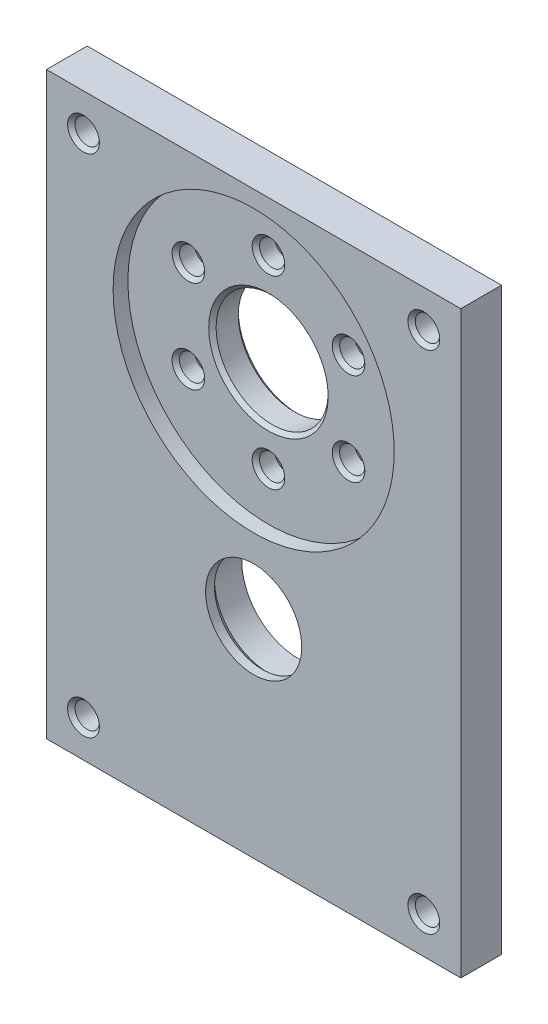
from build123d import *
from OCP.BRepFilletAPI import BRepFilletAPI_MakeChamfer

# Parameters (mm, degrees)
SKETCH1_W                                           = 56
SKETCH1_H                                           = 78.35
SKETCH1_R                                           = 6.5
SKETCH1_R_2                                         = 7.575
BOSS_EXTRUDE1_DEPTH                                 = 5
SKETCH1_4_W                                         = 56
SKETCH1_4_H                                         = 78.35
BOSS_EXTRUDE2_DEPTH                                 = 38
SKETCH4_W                                           = 2
SKETCH4_H                                           = 3
SKETCH7_W                                           = 4.75
SKETCH7_H                                           = 48
BOSS_EXTRUDE3_DEPTH                                 = 15.25
CHAMFER1_SIZE                                       = 17.35
CHAMFER1_SIZE_2                                     = 15.25
SKETCH9_W                                           = 2.7
SKETCH9_H                                           = 5.7
CUT_EXTRUDE11_DEPTH                                 = 8.5
CUT_EXTRUDE12_START                                 = 78.35
SKETCH9_3_W                                         = 2.7
SKETCH9_3_H                                         = 5.7
CUT_EXTRUDE12_DEPTH                                 = 8.5
SKETCH8_R                                           = 1.65
CUT_EXTRUDE5_DEPTH                                  = 175.5
BOSS_EXTRUDE4_START                                 = 38
SKETCH1_5_W                                         = 56
SKETCH1_5_H                                         = 78.35
BOSS_EXTRUDE4_DEPTH                                 = 6
CUT_EXTRUDE2_START                                  = -49
SKETCH2_R                                           = 1.65
CUT_EXTRUDE2_DEPTH                                  = 26
CUT_EXTRUDE6_START                                  = -49
CUT_EXTRUDE6_OUTLINE_R                              = 7.575
CUT_EXTRUDE6_OUTLINE_R_2                            = 6.5
CUT_EXTRUDE6_OUTLINE_R_3                            = 1.65
CUT_EXTRUDE6_DEPTH                                  = 6
CUT_EXTRUDE7_START                                  = -49
SKETCH10_3_R                                        = 19
CUT_EXTRUDE7_DEPTH                                  = 2
CUT_EXTRUDE8_START                                  = -43
SKETCH10_5_R                                        = 7.6
CUT_EXTRUDE8_DEPTH                                  = 4
CUT_EXTRUDE10_START                                 = -6
SKETCH11_2_W                                        = 56
SKETCH11_2_H                                        = 78.35
CUT_EXTRUDE10_DEPTH                                 = 58.25
CSK_FOR_M3_COUNTERSUNK_FLAT_HEAD_SCREW1_D           = 3.4
CSK_FOR_M3_COUNTERSUNK_FLAT_HEAD_SCREW1_DEPTH       = 47
CSK_FOR_M3_COUNTERSUNK_FLAT_HEAD_SCREW1_CSINK_D     = 6.3
CSK_FOR_M3_COUNTERSUNK_FLAT_HEAD_SCREW1_CSINK_ANGLE = 90
CSK_FOR_M3_COUNTERSUNK_FLAT_HEAD_SCREW1_TIP         = 1.021463052
CHAMFER4_SIZE                                       = 0.8
CHAMFER7_SIZE                                       = 0.5


# Read off the part's stored shape, not the designer's step: Cut-Extrude6
with BuildPart() as part:
    # Sketch1 → Boss-Extrude1 (new body)
    with BuildSketch(Plane.XY):
        with Locations((0, 11.175)):
            Rectangle(SKETCH1_W, SKETCH1_H)
        Circle(SKETCH1_R, mode=Mode.SUBTRACT)
        with Locations((0, 29.1)):
            Circle(SKETCH1_R_2, mode=Mode.SUBTRACT)
    extrude(amount=-BOSS_EXTRUDE1_DEPTH)

    # Sketch1<4> → Boss-Extrude2 (add)
    with BuildSketch(Plane.XY):
        with Locations((0, 11.175)):
            Rectangle(SKETCH1_4_W, SKETCH1_4_H)
        with BuildLine():
            ThreePointArc((-9.654082841, 21.972680412), (0, 41.1), (9.654082841, 21.972680412))
            ThreePointArc((9.654082841, 21.972680412), (0, -24), (-9.654082841, 21.972680412))
        make_face(mode=Mode.SUBTRACT)
    extrude(amount=BOSS_EXTRUDE2_DEPTH)

    # Cut-Sweep1: sweep along a path in Sketch3
    with BuildLine(Plane(origin=(0, 0, 38), x_dir=(-1, 0, 0), z_dir=(0, 0, -1))) as cut_sweep1_path:
        Line((26, 0), (26, 26.35))
        ThreePointArc((26, 26.35), (19.556349186, 41.906349186), (4, 48.35))
        Line((4, 48.35), (-4, 48.35))
        ThreePointArc((-4, 48.35), (-19.556349186, 41.906349186), (-26, 26.35))
        Line((-26, 26.35), (-26, -4))
        ThreePointArc((-26, -4), (-19.556349186, -19.556349186), (-4, -26))
        Line((-4, -26), (4, -26))
        ThreePointArc((4, -26), (19.556349186, -19.556349186), (26, -4))
        Line((26, -4), (26, 0))
    # Sketch4 → Cut-Sweep1 (sweep, cut)
    with BuildSketch(Plane(origin=(0, 0, 0), x_dir=(1, 0, 0), z_dir=(0, 1, 0))):
        with Locations((-26, -38.1)):
            Rectangle(SKETCH4_W, SKETCH4_H)
    sweep(path=cut_sweep1_path.line, mode=Mode.SUBTRACT)

    # Sketch7 → Boss-Extrude3 (add)
    with BuildSketch(Plane(origin=(0, 0, -5), x_dir=(-1, 0, 0), z_dir=(0, 0, -1))):
        with Locations((-25.625, 9)):
            Rectangle(SKETCH7_W, SKETCH7_H)
        with Locations((25.625, 9)):
            Rectangle(SKETCH7_W, SKETCH7_H)
    extrude(amount=BOSS_EXTRUDE3_DEPTH)

    # Chamfer1
    chamfer1_edges_1 = [part.edges().sort_by_distance(p)[0] for p in [
        (-25.625, 33, -5),
    ]]
    chamfer1_side_1 = [part.faces().sort_by_distance(p)[0] for p in [
        (-25.625, 33.305, -5),
    ]]
    chamfer1_edges_2 = [part.edges().sort_by_distance(p)[0] for p in [
        (25.625, 33, -5),
    ]]
    chamfer1_side_2 = [part.faces().sort_by_distance(p)[0] for p in [
        (25.625, 33.305, -5),
    ]]
    chamfer1 = BRepFilletAPI_MakeChamfer(part.part.solid().wrapped)
    for e in chamfer1_edges_1:
        chamfer1.Add(CHAMFER1_SIZE - 0.0001, CHAMFER1_SIZE_2 - 0.0001, e.wrapped, chamfer1_side_1[0].wrapped)
    for e in chamfer1_edges_2:
        chamfer1.Add(CHAMFER1_SIZE - 0.0001, CHAMFER1_SIZE_2 - 0.0001, e.wrapped, chamfer1_side_2[0].wrapped)
    add(Compound.cast(chamfer1.Shape()), mode=Mode.REPLACE)  # a hair under: the kernel refuses the full size

    # Sketch9 → Cut-Extrude11 (cut)
    with BuildSketch(Plane(origin=(-22.35, 50.35, 0), x_dir=(0, 0, -1), z_dir=(0, -1, 0))):
        with Locations((-33.65, -0.65)):
            Rectangle(SKETCH9_W, SKETCH9_H)
        with Locations((-33.65, 45.35)):
            Rectangle(SKETCH9_W, SKETCH9_H)
    extrude(amount=CUT_EXTRUDE11_DEPTH, mode=Mode.SUBTRACT)

    # Sketch9<3> → Cut-Extrude12 (cut)
    with BuildSketch(Plane(origin=(-22.35, 50.35, 0), x_dir=(0, 0, -1), z_dir=(0, -1, 0)).offset(CUT_EXTRUDE12_START)):
        with Locations((-33.65, -0.65)):
            Rectangle(SKETCH9_3_W, SKETCH9_3_H)
        with Locations((-33.65, 45.35)):
            Rectangle(SKETCH9_3_W, SKETCH9_3_H)
    extrude(amount=-CUT_EXTRUDE12_DEPTH, mode=Mode.SUBTRACT)

    # Sketch8 → Cut-Extrude5 (cut)
    with BuildSketch(Plane(origin=(28, 0, 0), x_dir=(0, 0, -1), z_dir=(1, 0, 0))):
        with Locations(Location((15.25, -9, 0), (0, 0, 270))):
            Circle(SKETCH8_R)
        with Locations(Location((15.25, 28, 0), (0, 0, 270))):
            Circle(SKETCH8_R)
    extrude(amount=-CUT_EXTRUDE5_DEPTH, mode=Mode.SUBTRACT)

    # Sketch1<5> → Boss-Extrude4 (add)
    with BuildSketch(Plane.XY.offset(BOSS_EXTRUDE4_START)):
        with Locations((0, 11.175)):
            Rectangle(SKETCH1_5_W, SKETCH1_5_H)
    extrude(amount=BOSS_EXTRUDE4_DEPTH)

    # Sketch2 → Cut-Extrude2 (cut)
    with BuildSketch(Plane(origin=(0, 0, -5), x_dir=(-1, 0, 0), z_dir=(0, 0, -1)).offset(CUT_EXTRUDE2_START)):
        with Locations(Location((-23, 45.35, 0), (0, 0, 180))):
            Circle(SKETCH2_R)
        with Locations(Location((23, 45.35, 0), (0, 0, 180))):
            Circle(SKETCH2_R)
        with Locations(Location((-23, -23, 0), (0, 0, 180))):
            Circle(SKETCH2_R)
        with Locations(Location((23, -23, 0), (0, 0, 180))):
            Circle(SKETCH2_R)
    extrude(amount=CUT_EXTRUDE2_DEPTH, mode=Mode.SUBTRACT)

    # Cut-Extrude6 outline → Cut-Extrude6 (cut)
    with BuildSketch(Plane(origin=(0, 0, -5), x_dir=(-1, 0, 0), z_dir=(0, 0, -1)).offset(CUT_EXTRUDE6_START)):
        with Locations((0, 29.1)):
            Circle(CUT_EXTRUDE6_OUTLINE_R)
        Circle(CUT_EXTRUDE6_OUTLINE_R_2)
        with Locations((-10.825317547, 35.35)):
            Circle(CUT_EXTRUDE6_OUTLINE_R_3)
        with Locations((-10.825317547, 22.85)):
            Circle(CUT_EXTRUDE6_OUTLINE_R_3)
        with Locations((0, 16.6)):
            Circle(CUT_EXTRUDE6_OUTLINE_R_3)
        with Locations((10.825317547, 22.85)):
            Circle(CUT_EXTRUDE6_OUTLINE_R_3)
        with Locations((10.825317547, 35.35)):
            Circle(CUT_EXTRUDE6_OUTLINE_R_3)
        with Locations((0, 41.6)):
            Circle(CUT_EXTRUDE6_OUTLINE_R_3)
    extrude(amount=CUT_EXTRUDE6_DEPTH, mode=Mode.SUBTRACT)

    # Sketch10<3> → Cut-Extrude7 (cut)
    with BuildSketch(Plane(origin=(0, 0, -5), x_dir=(-1, 0, 0), z_dir=(0, 0, -1)).offset(CUT_EXTRUDE7_START)):
        with Locations((0, 29.1)):
            Circle(SKETCH10_3_R)
    extrude(amount=CUT_EXTRUDE7_DEPTH, mode=Mode.SUBTRACT)

    # Sketch10<5> → Cut-Extrude8 (cut)
    with BuildSketch(Plane(origin=(0, 0, -5), x_dir=(-1, 0, 0), z_dir=(0, 0, -1)).offset(CUT_EXTRUDE8_START)):
        Circle(SKETCH10_5_R)
    extrude(amount=-CUT_EXTRUDE8_DEPTH, mode=Mode.SUBTRACT)

    # Sketch11<2> → Cut-Extrude10 (cut)
    with BuildSketch(Plane.XY.offset(44).offset(CUT_EXTRUDE10_START)):
        with Locations((0, 11.175)):
            Rectangle(SKETCH11_2_W, SKETCH11_2_H)
    extrude(amount=-CUT_EXTRUDE10_DEPTH, mode=Mode.SUBTRACT)

    # CSK for M3 Countersunk Flat Head Screw1
    with Locations(Plane(origin=(0, 0, 38), x_dir=(-1, 0, 0), z_dir=(0, 0, -1))):
        with Locations((-10.825317547, 35.35), (0, 41.6), (10.825317547, 35.35), (10.825317547, 22.85), (0, 16.6), (-10.825317547, 22.85)):
            CounterSinkHole(CSK_FOR_M3_COUNTERSUNK_FLAT_HEAD_SCREW1_D / 2, CSK_FOR_M3_COUNTERSUNK_FLAT_HEAD_SCREW1_CSINK_D / 2, depth=CSK_FOR_M3_COUNTERSUNK_FLAT_HEAD_SCREW1_DEPTH, counter_sink_angle=CSK_FOR_M3_COUNTERSUNK_FLAT_HEAD_SCREW1_CSINK_ANGLE)
            with Locations((0, 0, -(CSK_FOR_M3_COUNTERSUNK_FLAT_HEAD_SCREW1_DEPTH + CSK_FOR_M3_COUNTERSUNK_FLAT_HEAD_SCREW1_TIP / 2))):  # 118° drill point
                Cone(0, CSK_FOR_M3_COUNTERSUNK_FLAT_HEAD_SCREW1_D / 2, CSK_FOR_M3_COUNTERSUNK_FLAT_HEAD_SCREW1_TIP, mode=Mode.SUBTRACT)

    # Chamfer4
    chamfer4_edges = [part.edges().sort_by_distance(p)[0] for p in [
        (6.5, 0, 42),
    ]]
    chamfer(chamfer4_edges, length=CHAMFER4_SIZE)

    # Chamfer7
    chamfer7_edges = [part.edges().sort_by_distance(p)[0] for p in [
        (-24.65, 45.35, 44),
        (21.35, -23, 44),
        (-24.65, -23, 44),
        (21.35, 45.35, 44),
        (7.575, 29.1, 38),
        (7.575, 29.1, 42),
        (21.35, 45.35, 38),
        (-24.65, -23, 38),
        (21.35, -23, 38),
        (-24.65, 45.35, 38),
        (-28, 11.175, 38),
        (0, -28, 38),
        (28, 11.175, 38),
        (0, 50.35, 38),
        (9.125317547, 22.85, 42),
        (-1.7, 16.6, 42),
        (-12.525317547, 22.85, 42),
        (-12.525317547, 35.35, 42),
        (-1.7, 41.6, 42),
        (9.125317547, 35.35, 42),
    ]]
    chamfer(chamfer7_edges, length=CHAMFER7_SIZE)


solid = part.part
